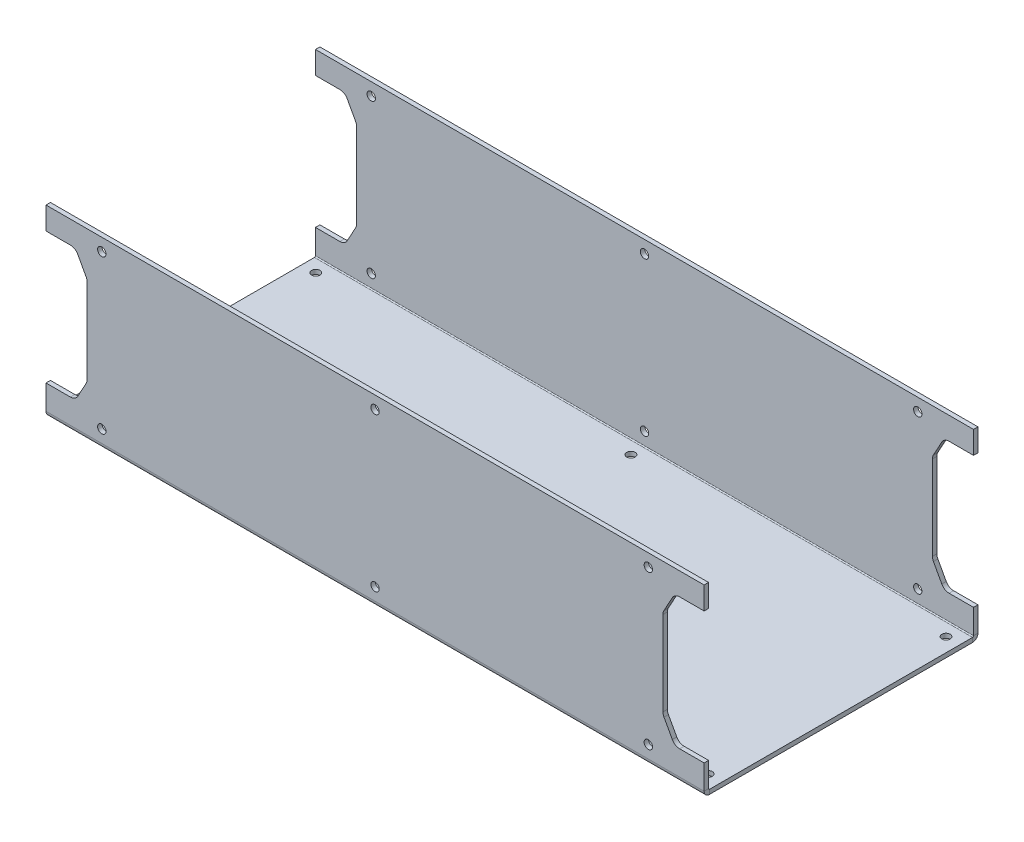
from build123d import *

# Parameters (mm, degrees)
BASE_FLANGE2_DEPTH      = 3.18
SKETCHED_START          = -235.915
SKETCHED_BEND1_DEPTH    = 471.83
SKETCHED_BEND1_2_DEPTH  = 471.83
CUT_EXTRUDE1_DEPTH      = 333.865793556
CUT_EXTRUDE1_DEPTH_BACK = 333.865793556
CUT_EXTRUDE2_DEPTH      = 333.865793556
CUT_EXTRUDE2_DEPTH_BACK = 333.865793556
SKETCH13_R              = 3
CUT_EXTRUDE3_DEPTH      = 288.595040156
CUT_EXTRUDE3_DEPTH_BACK = 288.595040156
SKETCH14_R              = 3


# Read off the part's stored shape, not the designer's step: Sketched Bend1
# Sheet-metal steps are written as plain solids
with BuildPart() as part:
    # Sketch1 → Base-Flange2 (new body)
    with BuildSketch(Plane(origin=(0, 0, 0), x_dir=(1, 0, 0), z_dir=(0, 1, 0))):
        Polygon((-235.915, -95), (-235.915, -225.97), (235.915, -225.97), (235.915, -95), (235.915, 95), (235.915, 225.97), (-235.915, 225.97), (-235.915, 95), align=None)
    extrude(amount=-BASE_FLANGE2_DEPTH)

    # Sketched Bend1 outline → Sketched Bend1 (cut)
    with BuildSketch(Plane.YZ.offset(SKETCHED_START)):
        with BuildLine():
            ThreePointArc((0, -98.110109763), (-2.282068839, -96.758874704), (-3.18, -94.2634))
            Line((-3.18, -94.2634), (-3.18, -225.97))
            Line((-3.18, -225.97), (0, -225.97))
            Line((0, -225.97), (0, -98.110109763))
        make_face()
        with BuildLine():
            Line((-3.18, 225.97), (-3.18, 94.2634))
            ThreePointArc((-3.18, 94.2634), (-2.282068839, 96.758874704), (0, 98.110109763))
            Line((0, 98.110109763), (0, 225.97))
            Line((0, 225.97), (-3.18, 225.97))
        make_face()
    extrude(amount=SKETCHED_BEND1_DEPTH, mode=Mode.SUBTRACT)

    # Sketched Bend1 2 outline → Sketched Bend1 2 (add)
    with BuildSketch(Plane.YZ.offset(SKETCHED_START)):
        with BuildLine():
            Line((0, -94.2634), (0, -98.110109763))
            ThreePointArc((0, -98.110109763), (0.366645879, -98.162488292), (0.7366, -98.18))
            Line((0.7366, -98.18), (128.788585266, -98.18))
            Line((128.788585266, -98.18), (128.788585266, -95))
            Line((128.788585266, -95), (0.7366, -95))
            ThreePointArc((0.7366, -95), (0.215745145, -94.784254855), (0, -94.2634))
        make_face()
        with BuildLine():
            ThreePointArc((0.7366, 98.18), (0.366645879, 98.162488292), (0, 98.110109763))
            Line((0, 98.110109763), (0, 94.2634))
            ThreePointArc((0, 94.2634), (0.215745145, 94.784254855), (0.7366, 95))
            Line((0.7366, 95), (128.788585266, 95))
            Line((128.788585266, 95), (128.788585266, 98.18))
            Line((128.788585266, 98.18), (0.7366, 98.18))
        make_face()
    extrude(amount=SKETCHED_BEND1_2_DEPTH)

    # Sketch11 → Cut-Extrude1 (cut, two sides: drawn at the far end of the back side and taken through both)
    with BuildSketch(Plane(origin=(0, 0, -98.18), x_dir=(-1, 0, 0), z_dir=(0, 0, -1)).offset(-CUT_EXTRUDE1_DEPTH_BACK)):
        with BuildLine():
            Line((-238.915, 18.3066), (-218.398065726, 18.3066))
            ThreePointArc((-218.398065726, 18.3066), (-215.338826457, 19.14510263), (-213.134647247, 21.426248301))
            Line((-213.134647247, 21.426248301), (-207.15158152, 32.359419665))
            ThreePointArc((-207.15158152, 32.359419665), (-206.602061377, 33.753250405), (-206.415, 35.239771364))
            Line((-206.415, 35.239771364), (-206.415, 95.705413902))
            ThreePointArc((-206.415, 95.705413902), (-206.602061377, 97.191934861), (-207.15158152, 98.585765601))
            Line((-207.15158152, 98.585765601), (-213.134647247, 109.518936965))
            ThreePointArc((-213.134647247, 109.518936965), (-215.338826457, 111.800082636), (-218.398065726, 112.638585266))
            Line((-218.398065726, 112.638585266), (-238.915, 112.638585266))
            Line((-238.915, 112.638585266), (-238.915, 18.3066))
        make_face()
        with BuildLine():
            Line((218.398065726, 112.638585266), (238.915, 112.638585266))
            Line((238.915, 112.638585266), (238.915, 18.3066))
            Line((238.915, 18.3066), (218.398065726, 18.3066))
            ThreePointArc((218.398065726, 18.3066), (215.338826457, 19.14510263), (213.134647247, 21.426248301))
            Line((213.134647247, 21.426248301), (207.15158152, 32.359419665))
            ThreePointArc((207.15158152, 32.359419665), (206.602061377, 33.753250405), (206.415, 35.239771364))
            Line((206.415, 35.239771364), (206.415, 95.705413902))
            ThreePointArc((206.415, 95.705413902), (206.602061377, 97.191934861), (207.15158152, 98.585765601))
            Line((207.15158152, 98.585765601), (213.134647247, 109.518936965))
            ThreePointArc((213.134647247, 109.518936965), (215.338826457, 111.800082636), (218.398065726, 112.638585266))
        make_face()
    extrude(amount=CUT_EXTRUDE1_DEPTH + CUT_EXTRUDE1_DEPTH_BACK, mode=Mode.SUBTRACT)

    # Sketch13 → Cut-Extrude2 (cut, two sides: drawn at the far end of the back side and taken through both)
    with BuildSketch(Plane(origin=(0, 0, -98.18), x_dir=(-1, 0, 0), z_dir=(0, 0, -1)).offset(-CUT_EXTRUDE2_DEPTH_BACK)):
        with Locations(Location((-195.915, 119.788585266, 0), (0, 0, 90))):
            Circle(SKETCH13_R)
        with Locations(Location((-195.915, 9.7366, 0), (0, 0, 90))):
            Circle(SKETCH13_R)
        with Locations(Location((195.915, 9.7366, 0), (0, 0, 90))):
            Circle(SKETCH13_R)
        with Locations(Location((195.915, 119.788585266, 0), (0, 0, 90))):
            Circle(SKETCH13_R)
        with Locations(Location((0, 119.788585266, 0), (0, 0, 90))):
            Circle(SKETCH13_R)
        with Locations(Location((0, 9.7366, 0), (0, 0, 90))):
            Circle(SKETCH13_R)
    extrude(amount=CUT_EXTRUDE2_DEPTH + CUT_EXTRUDE2_DEPTH_BACK, mode=Mode.SUBTRACT)

    # Sketch14 → Cut-Extrude3 (cut, two sides: drawn at the far end of the back side and taken through both)
    with BuildSketch(Plane.XZ.offset(3.18).offset(-CUT_EXTRUDE3_DEPTH_BACK)):
        with Locations(Location((-225.915, 85.2634, 0), (0, 0, 270))):
            Circle(SKETCH14_R)
        with Locations(Location((-225.915, -85.2634, 0), (0, 0, 270))):
            Circle(SKETCH14_R)
        with Locations(Location((225.915, -85.2634, 0), (0, 0, 270))):
            Circle(SKETCH14_R)
        with Locations(Location((225.915, 85.2634, 0), (0, 0, 270))):
            Circle(SKETCH14_R)
        with Locations(Location((0, 85.2634, 0), (0, 0, 270))):
            Circle(SKETCH14_R)
        with Locations(Location((0, -85.2634, 0), (0, 0, 270))):
            Circle(SKETCH14_R)
    extrude(amount=CUT_EXTRUDE3_DEPTH + CUT_EXTRUDE3_DEPTH_BACK, mode=Mode.SUBTRACT)


solid = part.part
